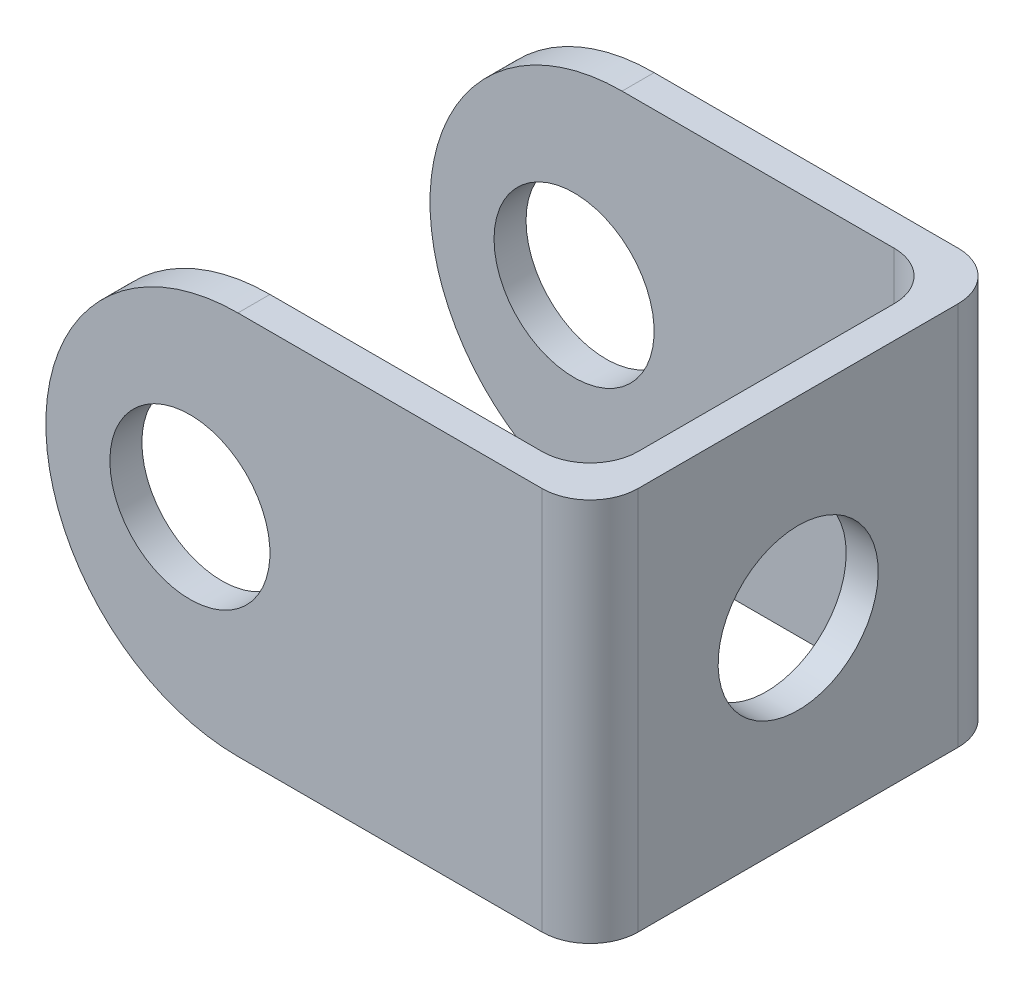
from build123d import *

# Parameters (mm, degrees)
SZKIC1_R                    = 5
DODANIE_WYCI_GNI_CIE1_DEPTH = 26
SZKIC2_W                    = 41.575535715
SZKIC2_H                    = 22
WYTNIJ_WYCI_GNI_CIE1_DEPTH  = 44.324358045
ZAOKR_GLENIE1_R             = 3
SZKIC3_R                    = 5
WYTNIJ_WYCI_GNI_CIE2_DEPTH  = 45.452221542


with BuildPart() as part:
    # Szkic1 → Dodanie-wyciągnięcie1 (new body)
    with BuildSketch(Plane.XY):
        with BuildLine():
            Line((3, 12), (25, 12))
            Line((25, 12), (25, -12))
            Line((25, -12), (3, -12))
            ThreePointArc((3, -12), (-9, 0), (3, 12))
        make_face()
        Circle(SZKIC1_R, mode=Mode.SUBTRACT)
    extrude(amount=DODANIE_WYCI_GNI_CIE1_DEPTH)

    # Szkic2 → Wytnij-wyciągnięcie1 (cut, through all)
    with BuildSketch(Plane(origin=(0, 12, 0), x_dir=(1, 0, 0), z_dir=(0, 1, 0))):
        with Locations((2.212232142, -13)):
            Rectangle(SZKIC2_W, SZKIC2_H)
    extrude(amount=-WYTNIJ_WYCI_GNI_CIE1_DEPTH, mode=Mode.SUBTRACT)

    # Zaokrąglenie1
    zaokr_glenie1_edges = [part.edges().sort_by_distance(p)[0] for p in [
        (23, 0, 24),
        (23, 0, 2),
        (25, 0, 0),
        (25, 0, 26),
    ]]
    fillet(zaokr_glenie1_edges, radius=ZAOKR_GLENIE1_R)

    # Szkic3 → Wytnij-wyciągnięcie2 (cut, through all)
    with BuildSketch(Plane(origin=(25, 0, 0), x_dir=(0, 0, -1), z_dir=(1, 0, 0))):
        with Locations((-13, 0)):
            Circle(SZKIC3_R)
    extrude(amount=-WYTNIJ_WYCI_GNI_CIE2_DEPTH, mode=Mode.SUBTRACT)


solid = part.part
